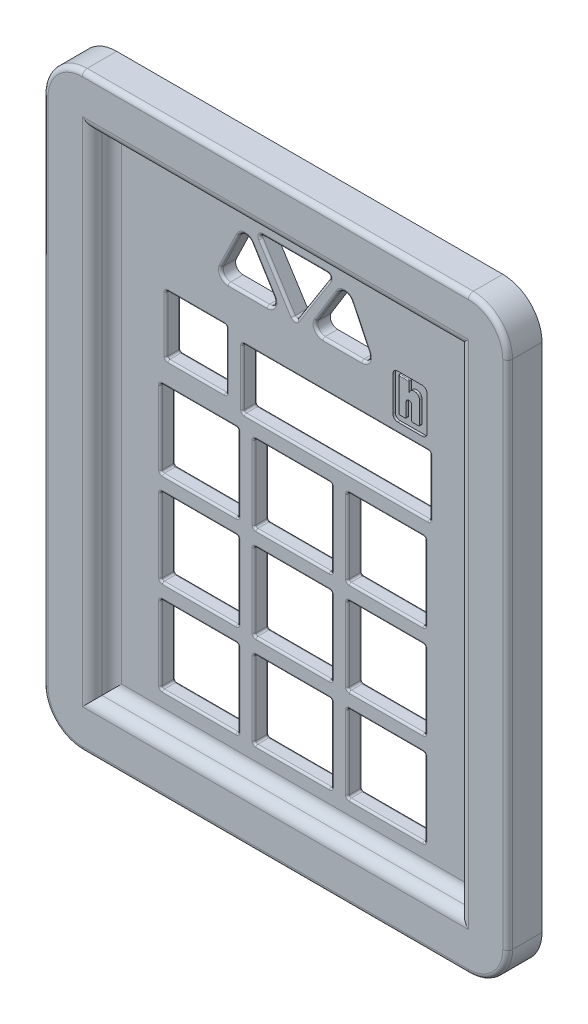
from build123d import *

# Parameters (mm, degrees)
SKETCH2_W           = 94.7
SKETCH2_H           = 120.2
SKETCH2_R           = 1.45
SKETCH2_W_2         = 12.3
SKETCH2_H_2         = 12.1
SKETCH2_W_3         = 38.2
SKETCH2_H_3         = 12.2
SKETCH2_W_4         = 15.8
SKETCH2_H_4         = 15.8
BOSS_EXTRUDE2_DEPTH = 3
FILLET1_R           = 0.4
SKETCH4_W           = 94.7
SKETCH4_H           = 120.2
SKETCH4_W_2         = 74.7
SKETCH4_H_2         = 100.2
BOSS_EXTRUDE3_DEPTH = 4
FILLET2_R           = 2
FILLET3_R           = 2
FILLET4_R           = 8
FILLET5_R           = 1
SKETCH5_W           = 7
SKETCH5_H           = 9
CUT_EXTRUDE1_DEPTH  = 0.5
FILLET6_R           = 1
FILLET8_R           = 0.2
CUT_EXTRUDE2_DEPTH  = 10
FILLET15_R          = 1.5
FILLET16_R          = 0.5


with BuildPart() as part:
    # Sketch2 → Boss-Extrude2 (new body)
    with BuildSketch(Plane.XY):
        Rectangle(SKETCH2_W, SKETCH2_H)
        with Locations((-42.35, 55.1)):
            Circle(SKETCH2_R, mode=Mode.SUBTRACT)
        with Locations((42.35, 55.1)):
            Circle(SKETCH2_R, mode=Mode.SUBTRACT)
        with Locations((42.35, -55.1)):
            Circle(SKETCH2_R, mode=Mode.SUBTRACT)
        with Locations((-42.35, -55.1)):
            Circle(SKETCH2_R, mode=Mode.SUBTRACT)
        with Locations((-20.15, 19.8)):
            Rectangle(SKETCH2_W_2, SKETCH2_H_2, mode=Mode.SUBTRACT)
        with Locations((8.41, 18.18)):
            Rectangle(SKETCH2_W_3, SKETCH2_H_3, mode=Mode.SUBTRACT)
        with Locations((-19.51, 0.99)):
            Rectangle(SKETCH2_W_4, SKETCH2_H_4, mode=Mode.SUBTRACT)
        with Locations((-0.46, 0.79)):
            Rectangle(SKETCH2_W_4, SKETCH2_H_4, mode=Mode.SUBTRACT)
        with Locations((18.59, 0.79)):
            Rectangle(SKETCH2_W_4, SKETCH2_H_4, mode=Mode.SUBTRACT)
        with Locations((-19.51, -18.06)):
            Rectangle(SKETCH2_W_4, SKETCH2_H_4, mode=Mode.SUBTRACT)
        with Locations((-0.46, -18.26)):
            Rectangle(SKETCH2_W_4, SKETCH2_H_4, mode=Mode.SUBTRACT)
        with Locations((18.59, -18.26)):
            Rectangle(SKETCH2_W_4, SKETCH2_H_4, mode=Mode.SUBTRACT)
        with Locations((-19.51, -37.11)):
            Rectangle(SKETCH2_W_4, SKETCH2_H_4, mode=Mode.SUBTRACT)
        with Locations((-0.46, -37.31)):
            Rectangle(SKETCH2_W_4, SKETCH2_H_4, mode=Mode.SUBTRACT)
        with Locations((18.59, -37.31)):
            Rectangle(SKETCH2_W_4, SKETCH2_H_4, mode=Mode.SUBTRACT)
    extrude(amount=BOSS_EXTRUDE2_DEPTH)

    # Fillet1
    fillet1_edges = [part.edges().sort_by_distance(p)[0] for p in [
        (18.59, 8.69, 3),
        (10.69, -29.41, 1.5),
        (10.69, -45.21, 1.5),
        (26.49, -45.21, 1.5),
        (26.49, -29.41, 1.5),
        (-8.36, -29.41, 1.5),
        (-8.36, -45.21, 1.5),
        (7.44, -45.21, 1.5),
        (7.44, -29.41, 1.5),
        (-27.41, -29.21, 1.5),
        (-27.41, -45.01, 1.5),
        (-11.61, -45.01, 1.5),
        (-11.61, -29.21, 1.5),
        (10.69, -10.36, 1.5),
        (10.69, -26.16, 1.5),
        (26.49, -26.16, 1.5),
        (26.49, -10.36, 1.5),
        (-8.36, -10.36, 1.5),
        (-8.36, -26.16, 1.5),
        (7.44, -26.16, 1.5),
        (7.44, -10.36, 1.5),
        (-27.41, -10.16, 1.5),
        (-27.41, -25.96, 1.5),
        (-11.61, -25.96, 1.5),
        (-11.61, -10.16, 1.5),
        (10.69, 8.69, 1.5),
        (10.69, -7.11, 1.5),
        (26.49, -7.11, 1.5),
        (26.49, 8.69, 1.5),
        (-8.36, 8.69, 1.5),
        (-8.36, -7.11, 1.5),
        (7.44, -7.11, 1.5),
        (7.44, 8.69, 1.5),
        (-27.41, 8.89, 1.5),
        (-27.41, -6.91, 1.5),
        (-11.61, -6.91, 1.5),
        (-11.61, 8.89, 1.5),
        (-10.69, 24.28, 1.5),
        (-10.69, 12.08, 1.5),
        (26.49, 0.79, 3),
        (27.51, 12.08, 1.5),
        (27.51, 24.28, 1.5),
        (-26.3, 25.85, 1.5),
        (-26.3, 13.75, 1.5),
        (-14, 13.75, 1.5),
        (-14, 25.85, 1.5),
        (18.59, -7.11, 3),
        (10.69, 0.79, 3),
        (-19.51, -10.16, 3),
        (-11.61, -18.06, 3),
        (-19.51, -25.96, 3),
        (-27.41, -18.06, 3),
        (-0.46, -10.36, 3),
        (7.44, -18.26, 3),
        (-0.46, -26.16, 3),
        (-8.36, -18.26, 3),
        (18.59, -10.36, 3),
        (26.49, -18.26, 3),
        (18.59, -26.16, 3),
        (10.69, -18.26, 3),
        (-19.51, -29.21, 3),
        (-11.61, -37.11, 3),
        (-19.51, -45.01, 3),
        (-27.41, -37.11, 3),
        (-20.15, 25.85, 3),
        (-0.46, -29.41, 3),
        (7.44, -37.31, 3),
        (-0.46, -45.21, 3),
        (-8.36, -37.31, 3),
        (18.59, -29.41, 3),
        (26.49, -37.31, 3),
        (18.59, -45.21, 3),
        (10.69, -37.31, 3),
        (-14, 19.8, 3),
        (-20.15, 13.75, 3),
        (-26.3, 19.8, 3),
        (8.41, 24.28, 3),
        (27.51, 18.18, 3),
        (8.41, 12.08, 3),
        (-10.69, 18.18, 3),
        (-19.51, 8.89, 3),
        (10.69, -37.31, 0),
        (18.59, -45.21, 0),
        (26.49, -37.31, 0),
        (-11.61, 0.99, 3),
        (18.59, -29.41, 0),
        (-8.36, -37.31, 0),
        (-0.46, -45.21, 0),
        (7.44, -37.31, 0),
        (-0.46, -29.41, 0),
        (-27.41, -37.11, 0),
        (-19.51, -45.01, 0),
        (-11.61, -37.11, 0),
        (-19.51, -29.21, 0),
        (10.69, -18.26, 0),
        (-19.51, -6.91, 3),
        (18.59, -26.16, 0),
        (26.49, -18.26, 0),
        (18.59, -10.36, 0),
        (-8.36, -18.26, 0),
        (-0.46, -26.16, 0),
        (7.44, -18.26, 0),
        (-0.46, -10.36, 0),
        (-27.41, -18.06, 0),
        (-19.51, -25.96, 0),
        (-11.61, -18.06, 0),
        (-27.41, 0.99, 3),
        (-19.51, -10.16, 0),
        (10.69, 0.79, 0),
        (18.59, -7.11, 0),
        (26.49, 0.79, 0),
        (18.59, 8.69, 0),
        (-8.36, 0.79, 0),
        (-0.46, -7.11, 0),
        (7.44, 0.79, 0),
        (-0.46, 8.69, 0),
        (-27.41, 0.99, 0),
        (-0.46, 8.69, 3),
        (-19.51, -6.91, 0),
        (-11.61, 0.99, 0),
        (-19.51, 8.89, 0),
        (-10.69, 18.18, 0),
        (8.41, 12.08, 0),
        (27.51, 18.18, 0),
        (8.41, 24.28, 0),
        (-26.3, 19.8, 0),
        (-20.15, 13.75, 0),
        (-14, 19.8, 0),
        (7.44, 0.79, 3),
        (-20.15, 25.85, 0),
        (-0.46, -7.11, 3),
        (-8.36, 0.79, 3),
    ]]
    fillet(fillet1_edges, radius=FILLET1_R)

    # Sketch4 → Boss-Extrude3 (add)
    with BuildSketch(Plane.XY.offset(3)):
        Rectangle(SKETCH4_W, SKETCH4_H)
        Rectangle(SKETCH4_W_2, SKETCH4_H_2, mode=Mode.SUBTRACT)
    extrude(amount=BOSS_EXTRUDE3_DEPTH)

    # Fillet2
    fillet2_edges = [part.edges().sort_by_distance(p)[0] for p in [
        (37.35, 0, 7),
        (0, 50.1, 7),
        (-37.35, 0, 7),
        (0, -50.1, 7),
    ]]
    fillet(fillet2_edges, radius=FILLET2_R)

    # Fillet3
    fillet3_edges = [part.edges().sort_by_distance(p)[0] for p in [
        (0, -50.1, 3),
        (37.35, 0, 3),
        (-37.35, 0, 3),
        (0, 50.1, 3),
    ]]
    fillet(fillet3_edges, radius=FILLET3_R - 0.0001)  # a hair under: the kernel refuses the full size

    # Fillet4
    fillet4_edges = [part.edges().sort_by_distance(p)[0] for p in [
        (47.35, -60.1, 3.5),
        (-47.35, -60.1, 3.5),
        (-47.35, 60.1, 3.5),
        (47.35, 60.1, 3.5),
    ]]
    fillet(fillet4_edges, radius=FILLET4_R)

    # Fillet5
    fillet5_edges = [part.edges().sort_by_distance(p)[0] for p in [
        (0, -60.1, 7),
        (-47.35, 0, 7),
        (0, 60.1, 7),
        (47.35, 0, 7),
        (-45.006854249, 57.756854249, 7),
        (45.006854249, 57.756854249, 7),
        (45.006854249, -57.756854249, 7),
        (-45.006854249, -57.756854249, 7),
    ]]
    fillet(fillet5_edges, radius=FILLET5_R)

    # Sketch5 → Cut-Extrude1 (cut)
    with BuildSketch(Plane.XY.offset(3)):
        with Locations((23.436954267, 30.797093777)):
            Rectangle(SKETCH5_W, SKETCH5_H)
        with BuildLine():
            Line((21.064326812, 27.746572763), (22.664326812, 27.746572763))
            Line((22.664326812, 27.746572763), (22.664326812, 30.735506394))
            ThreePointArc((22.664326812, 30.735506394), (23.229882896, 31.301062478), (23.795438981, 30.735506394))
            Line((23.795438981, 30.735506394), (23.795438981, 27.746572763))
            Line((23.795438981, 27.746572763), (25.395438981, 27.746572763))
            Line((25.395438981, 27.746572763), (25.395438981, 32.356373859))
            ThreePointArc((25.395438981, 32.356373859), (24.312660938, 33.439151901), (23.229882896, 32.356373859))
            Line((23.229882896, 32.356373859), (23.229882896, 34.807917328))
            Line((23.229882896, 34.807917328), (21.064326812, 34.807917328))
            Line((21.064326812, 34.807917328), (21.064326812, 27.746572763))
        make_face(mode=Mode.SUBTRACT)
    extrude(amount=-CUT_EXTRUDE1_DEPTH, mode=Mode.SUBTRACT)

    # Fillet6
    fillet6_edges = [part.edges().sort_by_distance(p)[0] for p in [
        (26.936954267, 35.297093777, 2.75),
        (26.936954267, 26.297093777, 2.75),
        (19.936954267, 26.297093777, 2.75),
        (19.936954267, 35.297093777, 2.75),
    ]]
    fillet(fillet6_edges, radius=FILLET6_R)

    # Fillet8
    fillet8_edges = [part.edges().sort_by_distance(p)[0] for p in [
        (21.064326812, 31.277245046, 3),
        (21.064326812, 34.807917328, 2.75),
        (22.147104854, 34.807917328, 3),
        (23.229882896, 34.807917328, 2.75),
        (25.395438981, 27.746572763, 2.75),
        (23.795438981, 27.746572763, 2.75),
        (22.664326812, 27.746572763, 2.75),
        (21.064326812, 27.746572763, 2.75),
    ]]
    fillet(fillet8_edges, radius=FILLET8_R)

    # Sketch6 → Cut-Extrude2 (cut)
    with BuildSketch(Plane.XY.offset(3)):
        Polygon((0, 33.528409582), (7.5, 45.35), (-7.5, 45.35), align=None)
        Polygon((-16, 33.528409582), (-3, 33.528409582), (-10.279896805, 45.35), align=None)
        Polygon((3, 33.528409582), (10.279896805, 45.35), (16, 33.528409582), align=None)
    extrude(amount=-CUT_EXTRUDE2_DEPTH, mode=Mode.SUBTRACT)

    # Fillet15
    fillet15_edges = [part.edges().sort_by_distance(p)[0] for p in [
        (-16, 33.528409582, 1.5),
        (-10.279896805, 45.35, 1.5),
        (-3, 33.528409582, 1.5),
        (16, 33.528409582, 1.5),
        (3, 33.528409582, 1.5),
        (10.279896805, 45.35, 1.5),
    ]]
    fillet(fillet15_edges, radius=FILLET15_R)

    # Fillet16
    fillet16_edges = [part.edges().sort_by_distance(p)[0] for p in [
        (0, 33.528409582, 1.5),
        (-7.5, 45.35, 1.5),
        (7.5, 45.35, 1.5),
        (-3.75, 39.439204791, 3),
        (3.75, 39.439204791, 3),
        (0, 45.35, 3),
        (13.215084416, 39.283923121, 3),
        (9.646576586, 33.528409582, 3),
        (6.626352756, 39.417127259, 3),
        (-6.626352756, 39.417127259, 3),
        (-9.646576586, 33.528409582, 3),
        (-13.215084416, 39.283923121, 3),
        (14.878653903, 34.231543579, 3),
        (4.375782735, 34.296909532, 3),
        (10.197810773, 43.730833906, 3),
        (-4.375782735, 34.296909532, 3),
        (-14.878653903, 34.231543579, 3),
        (-10.197810773, 43.730833906, 3),
    ]]
    fillet(fillet16_edges, radius=FILLET16_R)


solid = part.part
